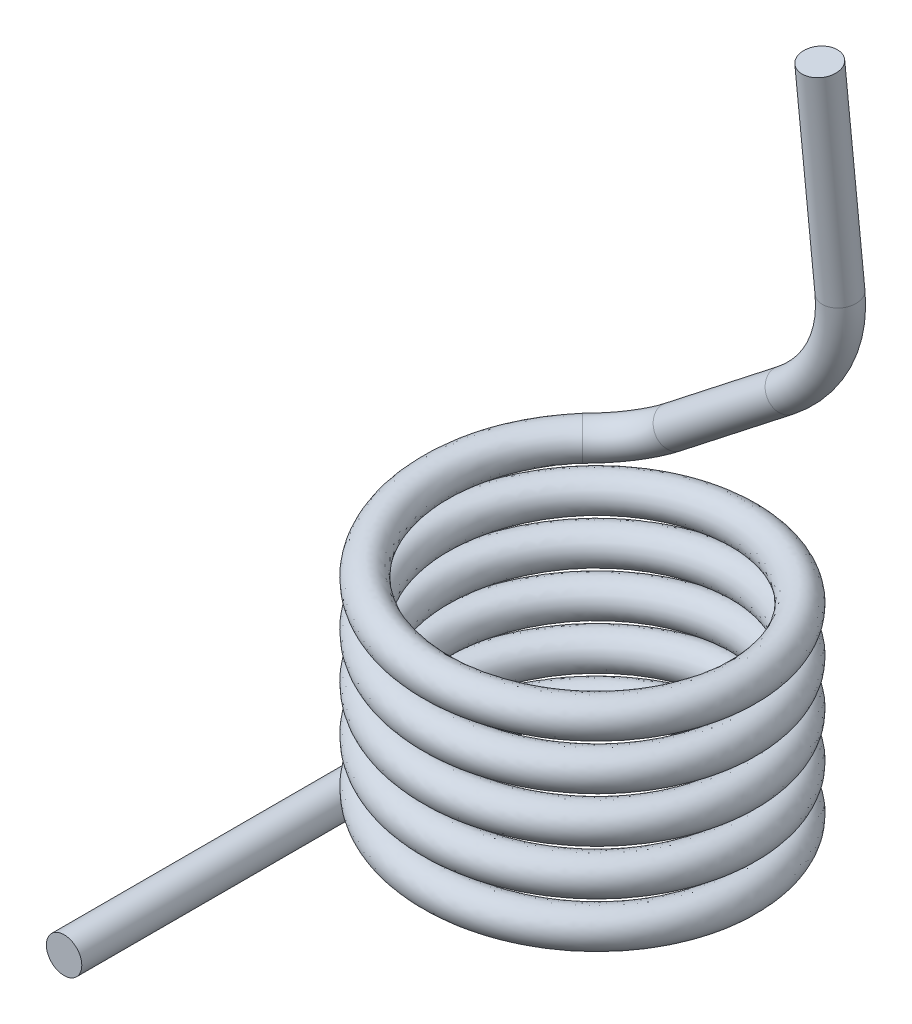
from build123d import *

# Parameters (mm, degrees)
SWEEP1_PITCH        = 7.14375
SWEEP1_HEIGHT       = 36.61171875
SWEEP1_RADIUS       = 24.13
SWEEP1_START_ANGLE  = -90
SKETCH2_R           = 2.778125
SKETCH4_R           = 2.778125
BOSS_EXTRUDE1_DEPTH = 57.15
SKETCH5_R           = 2.778125


with BuildPart() as part:
    # Sweep1: sweep along a helix
    with BuildLine() as sweep1_path:
        add(Helix(SWEEP1_PITCH, SWEEP1_HEIGHT, SWEEP1_RADIUS, center=(0, 0, 0), direction=(0, 1, 0), lefthand=True, mode=Mode.PRIVATE).rotate(Axis((0, 0, 0), (0, 1, 0)), SWEEP1_START_ANGLE))
    # Sketch2 → Sweep1 (sweep)
    with BuildSketch(Plane.XY):
        with Locations((-24.13, 0)):
            Circle(SKETCH2_R)
    sweep(path=sweep1_path.line, is_frenet=True)

    # Sketch4 → Boss-Extrude1 (add)
    with BuildSketch(Plane.XY):
        with Locations((-24.13, 0)):
            Circle(SKETCH4_R)
    extrude(amount=BOSS_EXTRUDE1_DEPTH)

    # Sweep2: sweep along a curve in space
    with BuildLine() as sweep2_path:
        Line((17.22751337, 70.543307735, -23.160975103), (17.22751337, 103.410309044, -19.985975103))
        ThreePointArc((8.33751337, 52.61452594, -23.41248663), (14.879259607, 60.545542265, -23.735723514), (17.22751337, 70.543307735, -23.160975103))
        Line((-7.729683232, 40.372212989, -21.919472112), (8.33751337, 52.61452594, -23.41248663))
        ThreePointArc((-17.06248663, 36.61252594, -17.06248663), (-12.5228552, 37.602926677, -20.423069563), (-7.729683232, 40.372212989, -21.919472112))
    # Sketch5 → Sweep2 (sweep)
    with BuildSketch(Plane(origin=(0, 0, 0), x_dir=(-0.7071067811865099, 0, -0.7071067811865851), z_dir=(0.7071067811865851, 0, -0.7071067811865099))):
        with Locations((24.13, 36.61252594)):
            Circle(SKETCH5_R)
    sweep(path=sweep2_path.line)


solid = part.part
